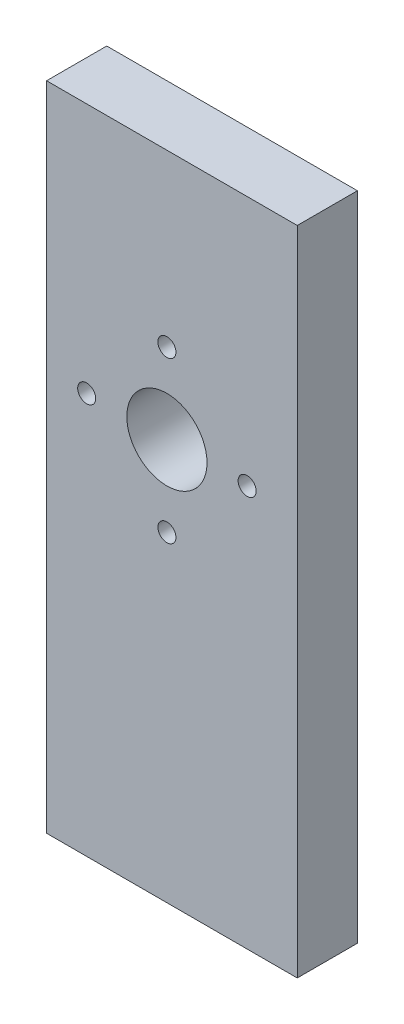
from build123d import *

# Parameters (mm, degrees)
ESQUISSE1_W             = 25
ESQUISSE1_H             = 65
ESQUISSE1_R             = 0.9
ESQUISSE1_R_2           = 4
BOSS_EXTRU_1_DEPTH      = 6
ESQUISSE4_R             = 1.5
ENL_V_MAT_EXTRU_3_DEPTH = 10


with BuildPart() as part:
    # Esquisse1 → Boss.-Extru.1 (new body)
    with BuildSketch(Plane.XY):
        with Locations((37.864568032, -83.170745263)):
            Rectangle(ESQUISSE1_W, ESQUISSE1_H)
        with Locations((29.364568032, -75.670745263)):
            Circle(ESQUISSE1_R, mode=Mode.SUBTRACT)
        with Locations((37.364568032, -67.670745263)):
            Circle(ESQUISSE1_R, mode=Mode.SUBTRACT)
        with Locations((45.364568032, -75.670745263)):
            Circle(ESQUISSE1_R, mode=Mode.SUBTRACT)
        with Locations((37.364568032, -83.670745263)):
            Circle(ESQUISSE1_R, mode=Mode.SUBTRACT)
        with Locations((37.364568032, -75.670745263)):
            Circle(ESQUISSE1_R_2, mode=Mode.SUBTRACT)
    extrude(amount=BOSS_EXTRU_1_DEPTH)

    # Esquisse4 → Enlèv. mat.-Extru.3 (cut)
    with BuildSketch(Plane.ZY.offset(-25.364568032)):
        with Locations((3, -55.670745263)):
            Circle(ESQUISSE4_R)
        with Locations((3, -110.670745263)):
            Circle(ESQUISSE4_R)
    extrude(amount=-ENL_V_MAT_EXTRU_3_DEPTH, mode=Mode.SUBTRACT)


solid = part.part
